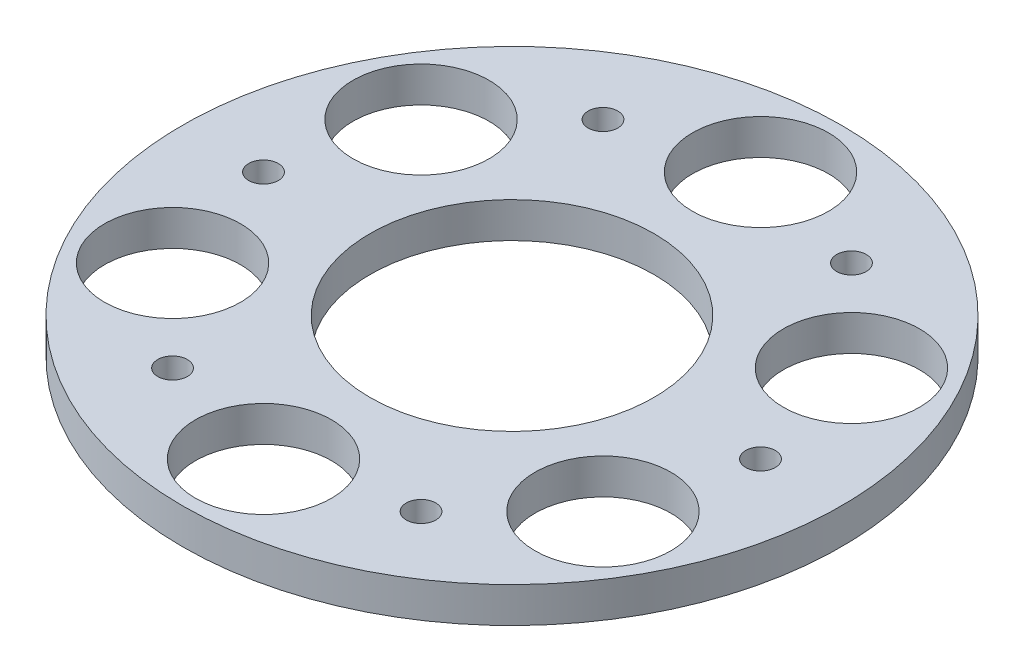
from build123d import *

# Parameters (mm, degrees)
SKETCH1_R           = 27.85
SKETCH1_R_2         = 5.75
SKETCH1_R_3         = 1.25
SKETCH1_R_4         = 12
BOSS_EXTRUDE1_DEPTH = 3


with BuildPart() as part:
    # Sketch1 → Boss-Extrude1 (new body)
    with BuildSketch(Plane(origin=(0, 0, 0), x_dir=(1, 0, 0), z_dir=(0, 1, 0))):
        Circle(SKETCH1_R)
        with Locations((0, 21)):
            Circle(SKETCH1_R_2, mode=Mode.SUBTRACT)
        with Locations((18.186533479, 10.5)):
            Circle(SKETCH1_R_2, mode=Mode.SUBTRACT)
        with Locations((18.186533479, -10.5)):
            Circle(SKETCH1_R_2, mode=Mode.SUBTRACT)
        with Locations((0, -21)):
            Circle(SKETCH1_R_2, mode=Mode.SUBTRACT)
        with Locations((-18.186533479, -10.5)):
            Circle(SKETCH1_R_2, mode=Mode.SUBTRACT)
        with Locations((-18.186533479, 10.5)):
            Circle(SKETCH1_R_2, mode=Mode.SUBTRACT)
        with Locations((10.5, 18.186533479)):
            Circle(SKETCH1_R_3, mode=Mode.SUBTRACT)
        with Locations((21, 0)):
            Circle(SKETCH1_R_3, mode=Mode.SUBTRACT)
        with Locations((10.5, -18.186533479)):
            Circle(SKETCH1_R_3, mode=Mode.SUBTRACT)
        with Locations((-10.5, -18.186533479)):
            Circle(SKETCH1_R_3, mode=Mode.SUBTRACT)
        with Locations((-21, 0)):
            Circle(SKETCH1_R_3, mode=Mode.SUBTRACT)
        with Locations((-10.5, 18.186533479)):
            Circle(SKETCH1_R_3, mode=Mode.SUBTRACT)
        Circle(SKETCH1_R_4, mode=Mode.SUBTRACT)
    extrude(amount=BOSS_EXTRUDE1_DEPTH)


solid = part.part
